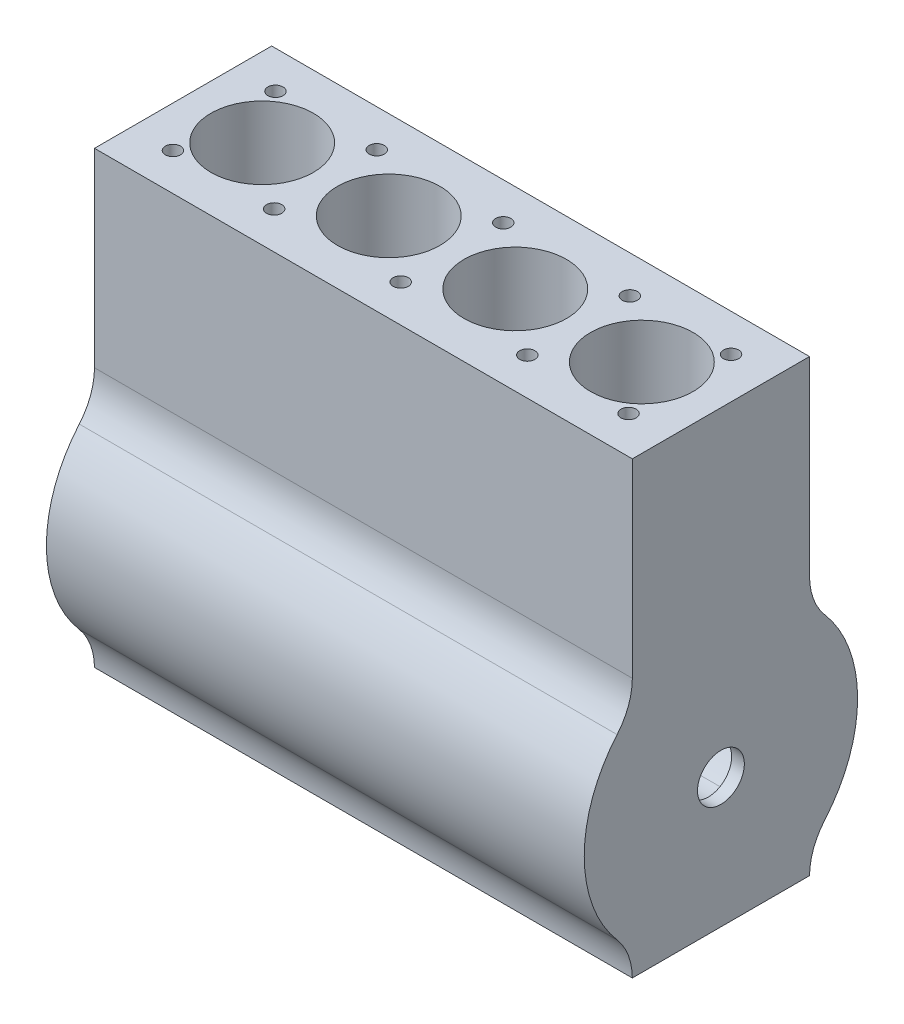
from build123d import *

# Parameters (mm, degrees)
BOSS_EXTRUDE1_DEPTH    = 350
SKETCH2_W              = 405
SKETCH2_H              = 120
CUT_EXTRUDE1_DEPTH     = 250
SKETCH3_R              = 18.5
CUT_EXTRUDE2_DEPTH     = 425
BOSS_EXTRUDE4_DEPTH    = 425
SKETCH7_R              = 99
CUT_EXTRUDE4_DEPTH     = 405
FILLET1_R              = 20
FILLET2_R              = 50
SKETCH8_W              = 425
SKETCH8_H              = 140
SKETCH8_R              = 6
SKETCH8_R_2            = 40.5015
BOSS_EXTRUDE5_DEPTH    = 5.28
CUT_EXTRUDE5_START     = -80
CUT_EXTRUDE5_OUTLINE_R = 6
CUT_EXTRUDE5_DEPTH     = 80
BOSS_EXTRUDE8_START    = -5.28
SKETCH10_R             = 6
BOSS_EXTRUDE8_DEPTH    = 5.28
SKETCH13_W             = 18.997
SKETCH13_H             = 60
BOSS_EXTRUDE9_DEPTH    = 147.68
CUT_EXTRUDE6_REACH     = 493.499
SKETCH14_R             = 20.5
SKETCH15_R             = 5
CUT_EXTRUDE7_DEPTH     = 50
BOSS_EXTRUDE10_START   = 103.0015
BOSS_EXTRUDE10_DEPTH   = 18.997
BOSS_EXTRUDE10_START_2 = 203.0015
BOSS_EXTRUDE10_2_DEPTH = 18.997
BOSS_EXTRUDE10_START_3 = 303.0015
BOSS_EXTRUDE10_3_DEPTH = 18.997
SKETCH17_W             = 18.997
SKETCH17_H             = 88.096247543
BOSS_EXTRUDE11_DEPTH   = 78
CUT_EXTRUDE8_START     = -425
CUT_EXTRUDE8_DEPTH     = 425
SKETCH19_R             = 2
CUT_EXTRUDE9_DEPTH     = 17


# Read off the part's stored shape, not the designer's step: Cut-Extrude5, Boss-Extrude10
with BuildPart() as part:
    # Sketch1 → Boss-Extrude1 (new body)
    with BuildSketch(Plane(origin=(0, 0, 0), x_dir=(1, 0, 0), z_dir=(0, 1, 0))):
        with BuildLine():
            Line((21.9985, 0), (0, 0))
            Line((0, 0), (0, -70))
            Line((0, -70), (425, -70))
            Line((425, -70), (425, 0))
            Line((425, 0), (403.0015, 0))
            ThreePointArc((403.0015, 0), (362.5, -40.5015), (321.9985, 0))
            Line((321.9985, 0), (303.0015, 0))
            ThreePointArc((303.0015, 0), (262.5, -40.5015), (221.9985, 0))
            Line((221.9985, 0), (203.0015, 0))
            ThreePointArc((203.0015, 0), (162.5, -40.5015), (121.9985, 0))
            Line((121.9985, 0), (103.0015, 0))
            ThreePointArc((103.0015, 0), (62.5, -40.5015), (21.9985, 0))
        make_face()
        with BuildLine():
            Line((0, 70), (0, 0))
            Line((0, 0), (21.9985, 0))
            ThreePointArc((21.9985, 0), (62.5, 40.5015), (103.0015, 0))
            Line((103.0015, 0), (121.9985, 0))
            ThreePointArc((121.9985, 0), (162.5, 40.5015), (203.0015, 0))
            Line((203.0015, 0), (221.9985, 0))
            ThreePointArc((221.9985, 0), (262.5, 40.5015), (303.0015, 0))
            Line((303.0015, 0), (321.9985, 0))
            ThreePointArc((321.9985, 0), (362.5, 40.5015), (403.0015, 0))
            Line((403.0015, 0), (425, 0))
            Line((425, 0), (425, 70))
            Line((425, 70), (0, 70))
        make_face()
    extrude(amount=BOSS_EXTRUDE1_DEPTH)

    # Sketch2 → Cut-Extrude1 (cut)
    with BuildSketch(Plane.XZ):
        with Locations((212.5, 0)):
            Rectangle(SKETCH2_W, SKETCH2_H)
    extrude(amount=-CUT_EXTRUDE1_DEPTH, mode=Mode.SUBTRACT)

    # Sketch3 → Cut-Extrude2 (cut)
    with BuildSketch(Plane.ZY):
        with Locations((0, 102.319709586)):
            Circle(SKETCH3_R)
    extrude(amount=-CUT_EXTRUDE2_DEPTH, mode=Mode.SUBTRACT)

    # Sketch5 → Boss-Extrude4 (add)
    with BuildSketch(Plane.ZY):
        with BuildLine():
            Line((-70, 20.076168806), (-70, 184.563250366))
            ThreePointArc((-70, 184.563250366), (-108, 102.319709586), (-70, 20.076168806))
        make_face()
        with BuildLine():
            ThreePointArc((70, 20.076168806), (108, 102.319709586), (70, 184.563250366))
            Line((70, 184.563250366), (70, 20.076168806))
        make_face()
    extrude(amount=-BOSS_EXTRUDE4_DEPTH)

    # Sketch7 → Cut-Extrude4 (cut)
    with BuildSketch(Plane.ZY.offset(-10)):
        with Locations((0, 102.319709586)):
            Circle(SKETCH7_R)
    extrude(amount=-CUT_EXTRUDE4_DEPTH, mode=Mode.SUBTRACT)

    # Fillet1
    fillet1_edges = [part.edges().sort_by_distance(p)[0] for p in [
        (212.5, 23.573281096, -60),
        (212.5, 181.066138077, -60),
        (212.5, 181.066138077, 60),
        (212.5, 23.573281096, 60),
    ]]
    fillet(fillet1_edges, radius=FILLET1_R)

    # Fillet2
    # the kernel refuses this fillet: 50 mm, written as the material it adds along each edge
    with BuildSketch(Plane(origin=(0, 184.563250366, -70), x_dir=(0, -0.7060057358717271, -0.7082061147125328), z_dir=(1, 0, 0))) as fillet2_piece_1:
        with BuildLine():
            CenterArc((20.910514914, 49.845268512), FILLET2_R, 224.9108533, 40.580418656)
            Line((-14.499790821, 14.544981719), (-15.207996936, 13.838975983))
            Line((-15.207996936, 13.838975983), (-0.708206115, -0.706005736))
            Line((-0.708206115, -0.706005736), (0.078610958, -0.99690537))
            ThreePointArc((0.078610958, -0.99690537), (8.489983499, -0.665779987), (16.90135604, -0.99690537))
            Line((16.90135604, -0.99690537), (16.979966998, 0))
        make_face()
    extrude(amount=425)
    with BuildSketch(Plane(origin=(0, 20.076168806, -70), x_dir=(0, -1, 0), z_dir=(1, 0, 0))) as fillet2_piece_2:
        with BuildLine():
            CenterArc((20.540295494, 49.997845818), FILLET2_R, 229.418380503, 40.049761852)
            Line((-11.986234973, 12.023843977), (-12.636765582, 11.26436394))
            ThreePointArc((-12.636765582, 11.26436394), (-6.464694875, 5.541819632), (-0.761514266, -0.648148148))
            Line((-0.761514266, -0.648148148), (0, -1))
            ThreePointArc((0, -1), (10.038084403, -1), (20.066886273, -0.999956916))
            Line((20.066886273, -0.999956916), (20.076168806, 0))
        make_face()
    extrude(amount=425)
    with BuildSketch(Plane(origin=(0, 20.076168806, 70), x_dir=(0, -1, 0), z_dir=(1, 0, 0))) as fillet2_piece_3:
        with BuildLine():
            CenterArc((20.540295494, -49.997845818), FILLET2_R, 90.531857645, 40.049761852)
            Line((-11.986234973, -12.023843977), (-12.636765582, -11.26436394))
            ThreePointArc((-12.636765582, -11.26436394), (-6.464694875, -5.541819632), (-0.761514266, 0.648148148))
            Line((-0.761514266, 0.648148148), (0, 1))
            ThreePointArc((0, 1), (10.038084403, 1), (20.066886273, 0.999956916))
            Line((20.066886273, 0.999956916), (20.076168806, 0))
        make_face()
    extrude(amount=425)
    with BuildSketch(Plane(origin=(0, 184.563250366, 70), x_dir=(0, 1, 0), z_dir=(1, 0, 0))) as fillet2_piece_4:
        with BuildLine():
            CenterArc((20.53778048, 50), FILLET2_R, 229.419581344, 40.580418656)
            Line((-11.987954096, 12.025316456), (-12.638468787, 11.265822785))
            ThreePointArc((-12.638468787, 11.265822785), (-6.465486506, 5.542613738), (-0.761514266, -0.648148148))
            Line((-0.761514266, -0.648148148), (0, -1))
            Line((0, -1), (20.53778048, -1))
            Line((20.53778048, -1), (20.53778048, 0))
        make_face()
    extrude(amount=425)

    # Sketch8 → Boss-Extrude5 (add)
    with BuildSketch(Plane(origin=(0, 350, 0), x_dir=(1, 0, 0), z_dir=(0, 1, 0))):
        with Locations((212.5, 0)):
            Rectangle(SKETCH8_W, SKETCH8_H)
        with Locations(Location((112.5, 40.5015, 0), (0, 0, 270))):
            Circle(SKETCH8_R, mode=Mode.SUBTRACT)
        with Locations(Location((112.5, -40.5015, 0), (0, 0, 270))):
            Circle(SKETCH8_R, mode=Mode.SUBTRACT)
        with Locations(Location((212.5, -40.5015, 0), (0, 0, 270))):
            Circle(SKETCH8_R, mode=Mode.SUBTRACT)
        with Locations(Location((212.5, 40.5015, 0), (0, 0, 270))):
            Circle(SKETCH8_R, mode=Mode.SUBTRACT)
        with Locations(Location((312.5, -40.5015, 0), (0, 0, 270))):
            Circle(SKETCH8_R, mode=Mode.SUBTRACT)
        with Locations(Location((312.5, 40.5015, 0), (0, 0, 270))):
            Circle(SKETCH8_R, mode=Mode.SUBTRACT)
        with Locations(Location((12.5, 40.5015, 0), (0, 0, 270))):
            Circle(SKETCH8_R, mode=Mode.SUBTRACT)
        with Locations(Location((12.5, -40.5015, 0), (0, 0, 270))):
            Circle(SKETCH8_R, mode=Mode.SUBTRACT)
        with Locations(Location((412.5, -40.5015, 0), (0, 0, 270))):
            Circle(SKETCH8_R, mode=Mode.SUBTRACT)
        with Locations(Location((412.5, 40.5015, 0), (0, 0, 270))):
            Circle(SKETCH8_R, mode=Mode.SUBTRACT)
        with Locations(Location((62.5, 0, 0), (0, 0, 90))):
            Circle(SKETCH8_R_2, mode=Mode.SUBTRACT)
        with Locations(Location((162.5, 0, 0), (0, 0, 90))):
            Circle(SKETCH8_R_2, mode=Mode.SUBTRACT)
        with Locations(Location((262.5, 0, 0), (0, 0, 90))):
            Circle(SKETCH8_R_2, mode=Mode.SUBTRACT)
        with Locations(Location((362.5, 0, 0), (0, 0, 90))):
            Circle(SKETCH8_R_2, mode=Mode.SUBTRACT)
    extrude(amount=BOSS_EXTRUDE5_DEPTH)

    # Cut-Extrude5 outline → Cut-Extrude5 (cut)
    with BuildSketch(Plane(origin=(0, 355.28, 0), x_dir=(1, 0, 0), z_dir=(0, 1, 0)).offset(CUT_EXTRUDE5_START)):
        with Locations((112.5, 40.5015)):
            Circle(CUT_EXTRUDE5_OUTLINE_R)
        with Locations((112.5, -40.5015)):
            Circle(CUT_EXTRUDE5_OUTLINE_R)
        with Locations((212.5, -40.5015)):
            Circle(CUT_EXTRUDE5_OUTLINE_R)
        with Locations((212.5, 40.5015)):
            Circle(CUT_EXTRUDE5_OUTLINE_R)
        with Locations((312.5, -40.5015)):
            Circle(CUT_EXTRUDE5_OUTLINE_R)
        with Locations((312.5, 40.5015)):
            Circle(CUT_EXTRUDE5_OUTLINE_R)
        with Locations((32.5, 40.5015)):
            Circle(CUT_EXTRUDE5_OUTLINE_R)
        with Locations((392.5, -40.5015)):
            Circle(CUT_EXTRUDE5_OUTLINE_R)
        with Locations((32.5, -40.5015)):
            Circle(CUT_EXTRUDE5_OUTLINE_R)
        with Locations((392.5, 40.5015)):
            Circle(CUT_EXTRUDE5_OUTLINE_R)
    extrude(amount=CUT_EXTRUDE5_DEPTH, mode=Mode.SUBTRACT)

    # Sketch10 → Boss-Extrude8 (add)
    with BuildSketch(Plane(origin=(0, 355.28, 0), x_dir=(1, 0, 0), z_dir=(0, 1, 0)).offset(BOSS_EXTRUDE8_START)):
        with Locations((12.5, 40.5015)):
            Circle(SKETCH10_R)
        with Locations((12.5, -40.5015)):
            Circle(SKETCH10_R)
        with Locations((412.5, -40.5015)):
            Circle(SKETCH10_R)
        with Locations((412.5, 40.5015)):
            Circle(SKETCH10_R)
    extrude(amount=BOSS_EXTRUDE8_DEPTH)

    # Sketch13 → Boss-Extrude9 (add)
    with BuildSketch(Plane.XZ.offset(-250)):
        with Locations((112.5, 30)):
            Rectangle(SKETCH13_W, SKETCH13_H)
        with Locations((212.5, 30)):
            Rectangle(SKETCH13_W, SKETCH13_H)
        with Locations((312.5, 30)):
            Rectangle(SKETCH13_W, SKETCH13_H)
        with Locations((112.5, -30)):
            Rectangle(SKETCH13_W, SKETCH13_H)
        with Locations((212.5, -30)):
            Rectangle(SKETCH13_W, SKETCH13_H)
        with Locations((312.5, -30)):
            Rectangle(SKETCH13_W, SKETCH13_H)
    extrude(amount=BOSS_EXTRUDE9_DEPTH)

    # Cut-Extrude6: up to this face of the body (flat: up to its plane)
    cut_extrude6_end = Plane(part.part.faces().sort_by_distance((321.9985, 176.16, 0))[0])
    # Sketch14 → Cut-Extrude6 (cut, up to the picked face)
    with BuildSketch(Plane.ZY.offset(-103.0015), mode=Mode.PRIVATE) as cut_extrude6_sk1:
        with Locations((0, 102.32)):
            Circle(SKETCH14_R)
    cut_extrude6_tool1 = split(extrude(cut_extrude6_sk1.sketch, amount=-CUT_EXTRUDE6_REACH, mode=Mode.PRIVATE), bisect_by=cut_extrude6_end, keep=Keep.BOTH, mode=Mode.PRIVATE)
    add(cut_extrude6_tool1.solids().sort_by(Axis((103.0015, 102.32, 0), (1, 0, 0)))[0], mode=Mode.SUBTRACT)

    # Sketch15 → Cut-Extrude7 (cut)
    with BuildSketch(Plane.XZ.offset(-102.32)):
        with Locations(Location((112.5, -30.25, 0), (0, 0, 270))):
            Circle(SKETCH15_R)
        with Locations(Location((112.5, 30.25, 0), (0, 0, 270))):
            Circle(SKETCH15_R)
        with Locations(Location((212.5, -30.25, 0), (0, 0, 270))):
            Circle(SKETCH15_R)
        with Locations(Location((212.5, 30.25, 0), (0, 0, 270))):
            Circle(SKETCH15_R)
        with Locations(Location((312.5, 30.25, 0), (0, 0, 270))):
            Circle(SKETCH15_R)
        with Locations(Location((312.5, -30.25, 0), (0, 0, 270))):
            Circle(SKETCH15_R)
    extrude(amount=-CUT_EXTRUDE7_DEPTH, mode=Mode.SUBTRACT)

    # Boss-Extrude10 outline → Boss-Extrude10 (add)
    with BuildSketch(Plane.YZ.offset(BOSS_EXTRUDE10_START)):
        with BuildLine():
            ThreePointArc((175.61010671, 66.554621849), (142.39534883, 90.525925233), (102.32, 99))
            Line((102.32, 99), (102.32, 60))
            Line((102.32, 60), (181.066138077, 60))
            ThreePointArc((181.066138077, 60), (178.408735422, 63.336088823), (175.61010671, 66.554621849))
        make_face()
    extrude(amount=BOSS_EXTRUDE10_DEPTH)

    # Boss-Extrude10 2 outline → Boss-Extrude10 2 (add)
    with BuildSketch(Plane.YZ.offset(BOSS_EXTRUDE10_START_2)):
        with BuildLine():
            ThreePointArc((175.61010671, 66.554621849), (142.39534883, 90.525925233), (102.32, 99))
            Line((102.32, 99), (102.32, 60))
            Line((102.32, 60), (181.066138077, 60))
            ThreePointArc((181.066138077, 60), (178.408735422, 63.336088823), (175.61010671, 66.554621849))
        make_face()
    extrude(amount=BOSS_EXTRUDE10_2_DEPTH)

    # Boss-Extrude10 3 outline → Boss-Extrude10 3 (add)
    with BuildSketch(Plane.YZ.offset(BOSS_EXTRUDE10_START_3)):
        with BuildLine():
            ThreePointArc((175.61010671, 66.554621849), (142.39534883, 90.525925233), (102.32, 99))
            Line((102.32, 99), (102.32, 60))
            Line((102.32, 60), (181.066138077, 60))
            ThreePointArc((181.066138077, 60), (178.408735422, 63.336088823), (175.61010671, 66.554621849))
        make_face()
    extrude(amount=BOSS_EXTRUDE10_3_DEPTH)

    # Sketch17 → Boss-Extrude11 (add)
    with BuildSketch(Plane(origin=(0, 0, -60), x_dir=(-1, 0, 0), z_dir=(0, 0, -1))):
        with Locations((-212.5, 146.368123772)):
            Rectangle(SKETCH17_W, SKETCH17_H)
        with Locations((-112.5, 146.368123772)):
            Rectangle(SKETCH17_W, SKETCH17_H)
        with Locations((-312.5, 146.368123772)):
            Rectangle(SKETCH17_W, SKETCH17_H)
    extrude(amount=BOSS_EXTRUDE11_DEPTH)

    # Sketch18 → Cut-Extrude8 (cut)
    with BuildSketch(Plane(origin=(425, 0, 0), x_dir=(0, 0, -1), z_dir=(1, 0, 0)).offset(CUT_EXTRUDE8_START)):
        with BuildLine():
            ThreePointArc((127.592646186, -6.969432781), (167.999999991, 102.317949061), (127.594936709, 211.606177762))
            Line((127.594936709, 211.606177762), (70, 211.606177762))
            Line((70, 211.606177762), (70, 205.101030846))
            ThreePointArc((70, 205.101030846), (73.102589745, 187.762261819), (82.025316456, 172.57529627))
            ThreePointArc((82.025316456, 172.57529627), (107.999999994, 102.31857782), (82.023843977, 32.062403779))
            ThreePointArc((82.023843977, 32.062403779), (73.181599395, 17.092611929), (70, 0))
            Line((70, 0), (127.592646186, -6.969432781))
        make_face()
    extrude(amount=CUT_EXTRUDE8_DEPTH, mode=Mode.SUBTRACT)

    # Sketch19 → Cut-Extrude9 (cut)
    with BuildSketch(Plane.XZ):
        with Locations(Location((5, 65, 0), (0, 0, 270))):
            Circle(SKETCH19_R)
        with Locations(Location((88, 65, 0), (0, 0, 270))):
            Circle(SKETCH19_R)
        with Locations(Location((171, 65, 0), (0, 0, 270))):
            Circle(SKETCH19_R)
        with Locations(Location((254, 65, 0), (0, 0, 270))):
            Circle(SKETCH19_R)
        with Locations(Location((337, 65, 0), (0, 0, 270))):
            Circle(SKETCH19_R)
        with Locations(Location((420, 65, 0), (0, 0, 270))):
            Circle(SKETCH19_R)
        with Locations(Location((420, -65, 0), (0, 0, 90))):
            Circle(SKETCH19_R)
        with Locations(Location((337, -65, 0), (0, 0, 90))):
            Circle(SKETCH19_R)
        with Locations(Location((254, -65, 0), (0, 0, 90))):
            Circle(SKETCH19_R)
        with Locations(Location((171, -65, 0), (0, 0, 90))):
            Circle(SKETCH19_R)
        with Locations(Location((88, -65, 0), (0, 0, 90))):
            Circle(SKETCH19_R)
        with Locations(Location((5, -65, 0), (0, 0, 90))):
            Circle(SKETCH19_R)
    extrude(amount=-CUT_EXTRUDE9_DEPTH, mode=Mode.SUBTRACT)


solid = part.part
